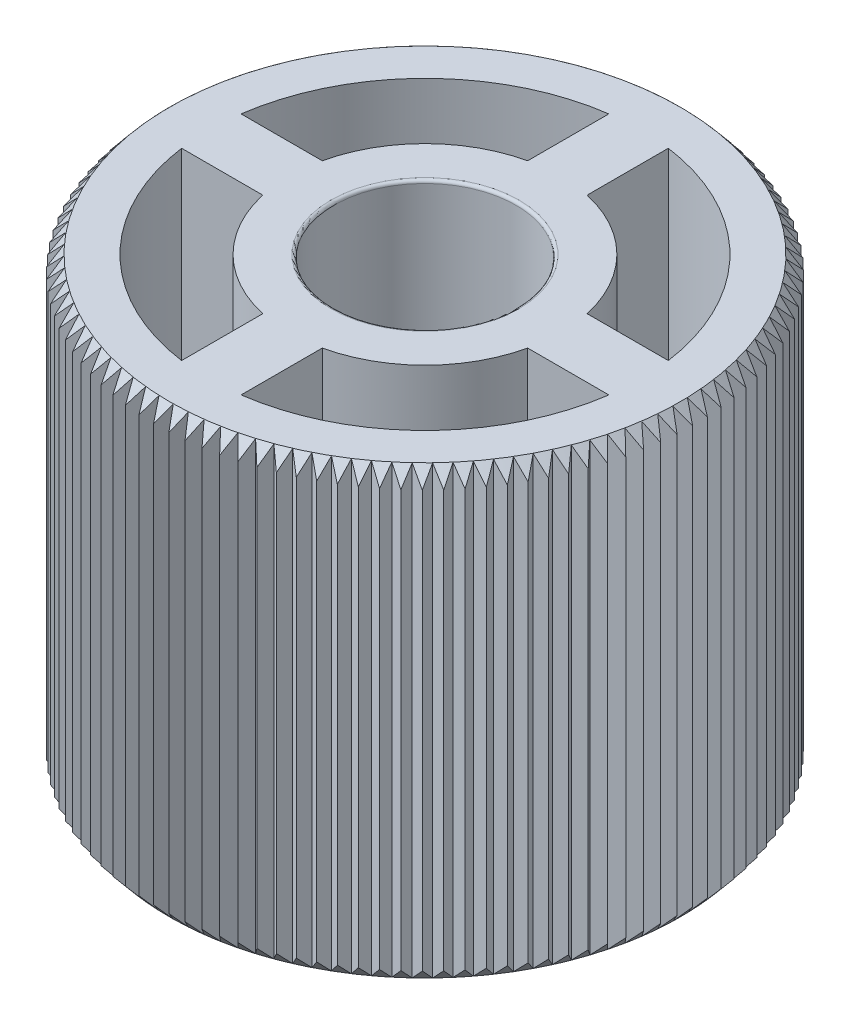
from build123d import *
from OCP.BRepFilletAPI import BRepFilletAPI_MakeChamfer

# Parameters (mm, degrees)
SKETCH1_R           = 9
SKETCH1_R_2         = 3.0625
BOSS_EXTRUDE1_DEPTH = 7.5
BOSS_EXTRUDE2_START = 7.5
SKETCH2_R           = 9
BOSS_EXTRUDE2_DEPTH = 7.5
SKETCH3_R           = 1
CUT_EXTRUDE1_DEPTH  = 2
CUT_EXTRUDE3_DEPTH  = 1
CUT_EXTRUDE4_START  = -3.5
SKETCH4_R           = 7.25
CUT_EXTRUDE4_DEPTH  = 3.5
CHAMFER1_SIZE       = 0.5
CHAMFER1_SIZE2      = 0.419549816
FILLET3_R           = 0.1
SKETCH8_R           = 9.899641267
CUT_EXTRUDE6_DEPTH  = 16


with BuildPart() as part:
    # Sketch1 → Boss-Extrude1 (new body)
    with BuildSketch(Plane(origin=(0, 0, 0), x_dir=(1, 0, 0), z_dir=(0, 1, 0))):
        Circle(SKETCH1_R)
        Circle(SKETCH1_R_2, mode=Mode.SUBTRACT)
        with BuildLine():
            Line((1, 4.451562226), (1, 7.180703308))
            ThreePointArc((1, 7.180703308), (5.126524164, 5.126524164), (7.180703308, 1))
            Line((7.180703308, 1), (4.451562226, 1))
            ThreePointArc((4.451562226, 1), (3.226174689, 3.226174689), (1, 4.451562226))
        make_face(mode=Mode.SUBTRACT)
        with BuildLine():
            Line((-1, 4.451562226), (-1, 7.180703308))
            ThreePointArc((-1, 7.180703308), (-5.126524164, 5.126524164), (-7.180703308, 1))
            Line((-7.180703308, 1), (-4.451562226, 1))
            ThreePointArc((-4.451562226, 1), (-3.226174689, 3.226174689), (-1, 4.451562226))
        make_face(mode=Mode.SUBTRACT)
        with BuildLine():
            Line((4.451562226, -1), (7.180703308, -1))
            ThreePointArc((7.180703308, -1), (5.126524164, -5.126524164), (1, -7.180703308))
            Line((1, -7.180703308), (1, -4.451562226))
            ThreePointArc((1, -4.451562226), (3.226174689, -3.226174689), (4.451562226, -1))
        make_face(mode=Mode.SUBTRACT)
        with BuildLine():
            Line((-1, -4.451562226), (-1, -7.180703308))
            ThreePointArc((-1, -7.180703308), (-5.126524164, -5.126524164), (-7.180703308, -1))
            Line((-7.180703308, -1), (-4.451562226, -1))
            ThreePointArc((-4.451562226, -1), (-3.226174689, -3.226174689), (-1, -4.451562226))
        make_face(mode=Mode.SUBTRACT)
    extrude(amount=BOSS_EXTRUDE1_DEPTH)

    # Sketch2 → Boss-Extrude2 (add)
    with BuildSketch(Plane(origin=(0, 0, 0), x_dir=(-1, 0, 0), z_dir=(0, -1, 0)).offset(BOSS_EXTRUDE2_START)):
        Circle(SKETCH2_R)
    extrude(amount=-BOSS_EXTRUDE2_DEPTH)

    # Sketch3 → Cut-Extrude1 (cut)
    with BuildSketch(Plane(origin=(0, 0, 0), x_dir=(1, 0, 0), z_dir=(0, 1, 0))):
        Circle(SKETCH3_R)
    extrude(amount=-CUT_EXTRUDE1_DEPTH, mode=Mode.SUBTRACT)

    # Sketch6 → Cut-Extrude3 (cut)
    with BuildSketch(Plane.XZ.offset(7.5)):
        with BuildLine():
            Line((0.5, -1.022961909), (0.5, -6.937229077))
            ThreePointArc((0.5, -6.937229077), (0, -7.437229077), (-0.5, -6.937229077))
            Line((-0.5, -6.937229077), (-0.5, -1.022961909))
            ThreePointArc((-0.5, -1.022961909), (0, -0.522961909), (0.5, -1.022961909))
        make_face()
    extrude(amount=-CUT_EXTRUDE3_DEPTH, mode=Mode.SUBTRACT)

    # Sketch4 → Cut-Extrude4 (cut)
    with BuildSketch(Plane(origin=(0, -2, 0), x_dir=(1, 0, 0), z_dir=(0, 1, 0)).offset(CUT_EXTRUDE4_START)):
        Circle(SKETCH4_R)
    extrude(amount=CUT_EXTRUDE4_DEPTH, mode=Mode.SUBTRACT)

    # Chamfer1: one chamfer whose edges measure the first distance from different faces: ONE call of the kernel's chamfer builder (chamfer() names one face for all edges)
    chamfer1_edges_1 = [part.edges().sort_by_distance(p)[0] for p in [
        (9, -7.5, 0),
    ]]
    chamfer1_side_1 = [part.faces().sort_by_distance(p)[0] for p in [
        (9, -3.75, 0),
    ]]
    chamfer1_edges_2 = [part.edges().sort_by_distance(p)[0] for p in [
        (-9, 7.5, 0),
    ]]
    chamfer1_side_2 = [part.faces().sort_by_distance(p)[0] for p in [
        (-9, 3.75, 0),
    ]]
    chamfer1 = BRepFilletAPI_MakeChamfer(part.part.solid().wrapped)
    for e in chamfer1_edges_1:
        chamfer1.Add(CHAMFER1_SIZE, CHAMFER1_SIZE2, e.wrapped, chamfer1_side_1[0].wrapped)  # the first distance lies on this face
    for e in chamfer1_edges_2:
        chamfer1.Add(CHAMFER1_SIZE, CHAMFER1_SIZE2, e.wrapped, chamfer1_side_2[0].wrapped)  # the first distance lies on this face
    add(Compound.cast(chamfer1.Shape()), mode=Mode.REPLACE)

    # Fillet3
    fillet3_edges = [part.edges().sort_by_distance(p)[0] for p in [
        (-3.0625, 7.5, 0),
    ]]
    fillet(fillet3_edges, radius=FILLET3_R)

    # Sketch8 → Cut-Extrude6 (cut)
    with BuildSketch(Plane(origin=(0, -7.5, 0), x_dir=(-1, 0, 0), z_dir=(0, -1, 0))):
        Circle(SKETCH8_R)
        Polygon((-8.579315838, -0.242882114), (-9, 0), (-8.579315838, 0.242882114), (-8.985585143, 0.509175443), (-8.551833703, 0.727868317), (-8.942386749, 1.016719843), (-8.496957467, 1.210522939), (-8.870543193, 1.521007383), (-8.414862914, 1.68929989), (-8.770284614, 2.020422678), (-8.305813018, 2.162665505), (-8.641932168, 2.51336595), (-8.170157099, 2.62910345), (-8.485897009, 2.998258153), (-8.008329704, 3.087119585), (-8.302678963, 3.473546031), (-7.820849214, 3.535246744), (-8.092864934, 3.937707094), (-7.608316187, 3.972049443), (-7.857127018, 4.389254494), (-7.371411429, 4.396128469), (-7.596220356, 4.826741789), (-7.110893818, 4.806125371), (-7.31098071, 5.248767575), (-6.827597871, 5.200726804), (-7.002321789, 5.653979976), (-6.522431069, 5.578668742), (-6.67123232, 6.041080974), (-6.196370954, 5.938740521), (-6.318772882, 6.408830569), (-5.850461995, 6.279788725), (-5.946072511, 6.756050747), (-5.485812242, 6.600720871), (-5.554325076, 7.081629258), (-5.103589779, 6.900508919), (-5.144785463, 7.384523176), (-4.705018979, 7.178192557), (-4.718765552, 7.66376224), (-4.291376585, 7.43288228), (-4.277630012, 7.918451962), (-3.863987618, 7.66376224), (-3.822791934, 8.147776496), (-3.424221134, 7.870092859), (-3.3557083, 8.351001246), (-2.973485837, 8.051213198), (-2.877875321, 8.52747522), (-2.513225568, 8.206543074), (-2.39082364, 8.676633121), (-2.044914681, 8.335584918), (-1.89611343, 8.797997151), (-1.570053315, 8.437925371), (-1.395329397, 8.891178542), (-1.090162595, 8.513236605), (-0.890075703, 8.955878809), (-0.606779756, 8.561277376), (-0.381970829, 8.991890696), (-0.121453218, 8.581893794), (0.127357613, 8.999098846), (0.364262371, 8.575019819), (0.636278091, 8.977480169), (0.848811118, 8.540677471), (1.143160378, 8.927103917), (1.330640867, 8.478976758), (1.646380777, 8.84813146), (1.808208172, 8.390115326), (2.144327323, 8.74081577), (2.279983242, 8.274377825), (2.635404941, 8.605500613), (2.744454837, 8.132134998), (3.118040564, 8.442619442), (3.200135117, 7.96384249), (3.590688162, 8.252694016), (3.645564398, 7.770039395), (4.051833703, 8.036332723), (4.079315838, 7.55134652), (4.5, 7.794228634), (4.5, 7.308464406), (4.93375144, 7.527157281), (4.906269305, 7.042171077), (5.351698587, 7.235974173), (5.29682235, 6.753319552), (5.752502629, 6.921612059), (5.670408077, 6.442835108), (6.134879672, 6.585077935), (6.025829776, 6.11171232), (6.497604846, 6.227449821), (6.361948927, 5.761011876), (6.839516232, 5.849873307), (6.677688837, 5.391857173), (7.159518586, 5.453557886), (6.972038096, 5.005430727), (7.456586843, 5.039773075), (7.244053816, 4.602970377), (7.729769405, 4.609844352), (7.492864647, 4.185765325), (7.978191185, 4.165148907), (7.717673574, 3.755152005), (8.201056413, 3.707111234), (7.917760466, 3.312509801), (8.397651186, 3.237198567), (8.092484384, 2.859256629), (8.56734575, 2.756916176), (8.241285635, 2.396844397), (8.709596522, 2.267802552), (8.363687563, 1.926754349), (8.823947832, 1.771424473), (8.459298079, 1.450492326), (8.910033376, 1.269371987), (8.527810913, 0.969583939), (8.967577397, 0.76325332), (8.569006597, 0.485569683), (8.996395564, 0.254689723), (8.58275317, 0), (8.996395564, -0.254689723), (8.569006597, -0.485569683), (8.967577397, -0.76325332), (8.527810913, -0.969583939), (8.910033376, -1.269371987), (8.459298079, -1.450492326), (8.823947832, -1.771424473), (8.363687563, -1.926754349), (8.709596522, -2.267802552), (8.241285635, -2.396844397), (8.56734575, -2.756916176), (8.092484384, -2.859256629), (8.397651186, -3.237198567), (7.917760466, -3.312509801), (8.201056413, -3.707111234), (7.717673574, -3.755152005), (7.978191185, -4.165148907), (7.492864647, -4.185765325), (7.729769405, -4.609844352), (7.244053816, -4.602970377), (7.456586843, -5.039773075), (6.972038096, -5.005430727), (7.159518586, -5.453557886), (6.677688837, -5.391857173), (6.839516232, -5.849873307), (6.361948927, -5.761011876), (6.497604846, -6.227449821), (6.025829776, -6.11171232), (6.134879672, -6.585077935), (5.670408077, -6.442835108), (5.75250263, -6.921612059), (5.29682235, -6.753319552), (5.351698587, -7.235974173), (4.906269305, -7.042171077), (4.93375144, -7.527157281), (4.5, -7.308464406), (4.5, -7.794228634), (4.079315838, -7.55134652), (4.051833703, -8.036332723), (3.645564398, -7.770039395), (3.590688162, -8.252694016), (3.200135117, -7.96384249), (3.118040564, -8.442619442), (2.744454837, -8.132134998), (2.635404941, -8.605500613), (2.279983242, -8.274377825), (2.144327323, -8.74081577), (1.808208172, -8.390115326), (1.646380777, -8.84813146), (1.330640867, -8.478976758), (1.143160378, -8.927103917), (0.848811118, -8.540677471), (0.636278091, -8.977480169), (0.364262371, -8.575019819), (0.127357613, -8.999098846), (-0.121453218, -8.581893794), (-0.381970829, -8.991890696), (-0.606779756, -8.561277376), (-0.890075703, -8.955878809), (-1.090162595, -8.513236605), (-1.395329397, -8.891178542), (-1.570053315, -8.437925371), (-1.89611343, -8.797997151), (-2.044914681, -8.335584918), (-2.39082364, -8.676633121), (-2.513225568, -8.206543074), (-2.877875321, -8.52747522), (-2.973485837, -8.051213198), (-3.3557083, -8.351001246), (-3.424221134, -7.870092859), (-3.822791934, -8.147776496), (-3.863987618, -7.66376224), (-4.277630012, -7.918451962), (-4.291376585, -7.43288228), (-4.718765552, -7.66376224), (-4.705018979, -7.178192557), (-5.144785463, -7.384523176), (-5.103589779, -6.900508919), (-5.554325076, -7.081629258), (-5.485812242, -6.600720871), (-5.946072511, -6.756050747), (-5.850461995, -6.279788725), (-6.318772882, -6.408830569), (-6.196370954, -5.938740521), (-6.67123232, -6.041080974), (-6.522431069, -5.578668742), (-7.002321789, -5.653979976), (-6.827597871, -5.200726804), (-7.31098071, -5.248767575), (-7.110893818, -4.806125371), (-7.596220356, -4.826741789), (-7.371411429, -4.396128469), (-7.857127018, -4.389254494), (-7.608316187, -3.972049443), (-8.092864934, -3.937707094), (-7.820849214, -3.535246744), (-8.302678963, -3.473546031), (-8.008329704, -3.087119585), (-8.485897009, -2.998258153), (-8.170157099, -2.62910345), (-8.641932168, -2.51336595), (-8.305813018, -2.162665505), (-8.770284614, -2.020422678), (-8.414862914, -1.68929989), (-8.870543193, -1.521007383), (-8.496957467, -1.210522939), (-8.942386749, -1.016719843), (-8.551833703, -0.727868317), (-8.985585143, -0.509175443), align=None, mode=Mode.SUBTRACT)
    extrude(amount=-CUT_EXTRUDE6_DEPTH, mode=Mode.SUBTRACT)


solid = part.part
